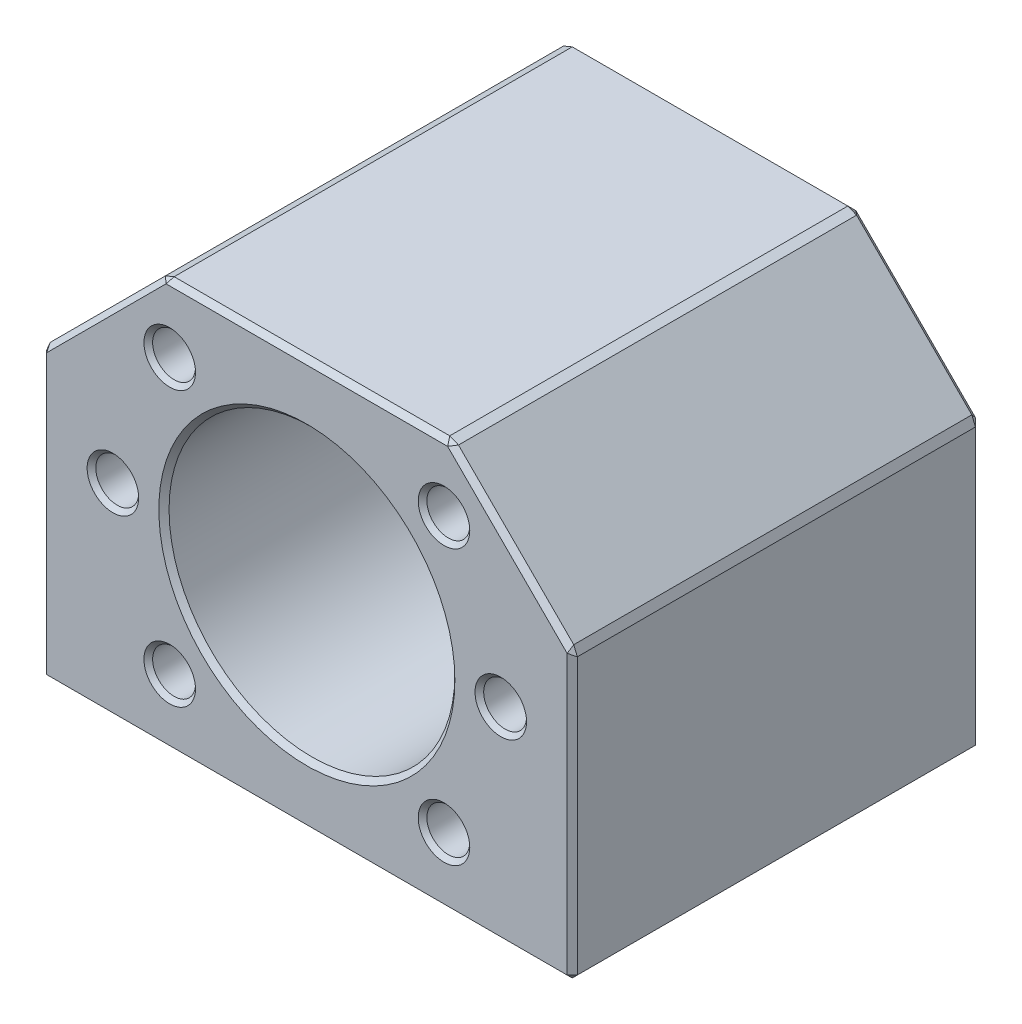
from build123d import *

# Parameters (mm, degrees)
SKETCH1_R                                 = 14
BOSS_EXTRUDE1_DEPTH                       = 20
M5X0_8_TAPPED_HOLE1_D                     = 4.2
M5X0_8_TAPPED_HOLE1_DEPTH                 = 12.4
M5X0_8_TAPPED_HOLE1_CSINK_D               = 5.05
M5X0_8_TAPPED_HOLE1_CSINK_ANGLE           = 90
M5X0_8_TAPPED_HOLE1_TIP                   = 1.2618073
M5X0_8_TAPPED_HOLE1_ON_FACE_2_D           = 4.2
M5X0_8_TAPPED_HOLE1_ON_FACE_2_DEPTH       = 12.4
M5X0_8_TAPPED_HOLE1_ON_FACE_2_CSINK_D     = 5.05
M5X0_8_TAPPED_HOLE1_ON_FACE_2_CSINK_ANGLE = 90
M5X0_8_TAPPED_HOLE1_ON_FACE_2_TIP         = 1.2618073


with BuildPart() as part:
    # Sketch1 → Boss-Extrude1 (new, symmetric)
    with BuildSketch(Plane.XY):
        Polygon((26, -20), (26, 8), (14, 20), (-14, 20), (-26, 8), (-26, -20), align=None)
        Circle(SKETCH1_R, mode=Mode.SUBTRACT)
    extrude(amount=BOSS_EXTRUDE1_DEPTH, both=True)

    # M5x0.8 Tapped Hole1
    with Locations(Plane(origin=(13.435028843, 13.435028843, 20), x_dir=(1, 0, 0), z_dir=(0, 0, 1))):
        with Locations((0, 0), (5.564971157, -13.435028843), (0, -26.870057686), (-26.870057686, -26.870057686), (-32.435028843, -13.435028843), (-26.870057686, 0)):
            CounterSinkHole(M5X0_8_TAPPED_HOLE1_D / 2, M5X0_8_TAPPED_HOLE1_CSINK_D / 2, depth=M5X0_8_TAPPED_HOLE1_DEPTH, counter_sink_angle=M5X0_8_TAPPED_HOLE1_CSINK_ANGLE)
            with Locations((0, 0, -(M5X0_8_TAPPED_HOLE1_DEPTH + M5X0_8_TAPPED_HOLE1_TIP / 2))):  # 118° drill point
                Cone(0, M5X0_8_TAPPED_HOLE1_D / 2, M5X0_8_TAPPED_HOLE1_TIP, mode=Mode.SUBTRACT)

    # M5x0.8 Tapped Hole1 on face 2
    with Locations(Plane(origin=(20, -20, 12), x_dir=(0, 0, -1), z_dir=(0, -1, 0))):
        with Locations((0, 0), (24, 0), (24, -40), (0, -40)):
            CounterSinkHole(M5X0_8_TAPPED_HOLE1_ON_FACE_2_D / 2, M5X0_8_TAPPED_HOLE1_ON_FACE_2_CSINK_D / 2, depth=M5X0_8_TAPPED_HOLE1_ON_FACE_2_DEPTH, counter_sink_angle=M5X0_8_TAPPED_HOLE1_ON_FACE_2_CSINK_ANGLE)
            with Locations((0, 0, -(M5X0_8_TAPPED_HOLE1_ON_FACE_2_DEPTH + M5X0_8_TAPPED_HOLE1_ON_FACE_2_TIP / 2))):  # 118° drill point
                Cone(0, M5X0_8_TAPPED_HOLE1_ON_FACE_2_D / 2, M5X0_8_TAPPED_HOLE1_ON_FACE_2_TIP, mode=Mode.SUBTRACT)

    # Chamfer1
    # the kernel refuses this chamfer: 0.5 mm, written as the material it takes off along each edge
    with BuildSketch(Plane(origin=(25.715482203, 7.88214887, 19.666666667), x_dir=(-0.6532814824381883, 0.38268343236508934, 0.6532814824381883), z_dir=(0.7569751589577588, 0.31354937721983284, 0.5733021862560186)), Plane(origin=(-13.88214887, 19.715482203, 19.666666667), x_dir=(-0.38268343236508734, -0.653281482438189, 0.653281482438189), z_dir=(-0.3135493772198326, 0.7569751589577584, 0.5733021862560194))) as chamfer1_piece_1:
        Polygon((-0.440992496, 0.245543339), (0.324374368, 0.245543339), (0.116618128, -0.491086678), align=None)
    extrude(amount=0.48776836, mode=Mode.SUBTRACT)
    with BuildSketch(Plane(origin=(13.88214887, 19.715482203, 19.666666667), x_dir=(0.3826834323650941, -0.6532814824381893, 0.6532814824381846), z_dir=(0.3135493772198325, 0.7569751589577581, 0.57330218625602)), Plane(origin=(-13.88214887, 19.715482203, -19.666666667), x_dir=(-0.38268343236508734, -0.653281482438189, -0.653281482438189), z_dir=(-0.3135493772198326, 0.7569751589577584, -0.5733021862560194))) as chamfer1_piece_2:
        Polygon((-0.440992496, -0.245543339), (0.324374368, -0.245543339), (0.116618128, 0.491086678), align=None)
    extrude(amount=0.48776836, mode=Mode.SUBTRACT)
    with BuildSketch(Plane(origin=(-25.666666667, -19.666666667, 19.666666667), x_dir=(-0.7071067811865475, 0.7071067811865475, 0), z_dir=(-0.5773502691896258, -0.5773502691896258, 0.5773502691896258)), Plane(origin=(25.666666667, -19.666666667, 19.666666667), x_dir=(-0.7071067811865475, -0.7071067811865475, 0), z_dir=(0.5773502691896258, -0.5773502691896258, 0.5773502691896258))) as chamfer1_piece_3:
        Polygon((-0.353553391, 0.204124145), (0.353553391, 0.204124145), (0, -0.40824829), align=None)
    extrude(amount=0.635085296, mode=Mode.SUBTRACT)
    with BuildSketch(Plane(origin=(-25.666666667, -19.666666667, -19.666666667), x_dir=(0, -0.7071067811865475, 0.7071067811865475), z_dir=(-0.5773502691896258, -0.5773502691896258, -0.5773502691896258)), Plane(origin=(25.666666667, -19.666666667, -19.666666667), x_dir=(-0.7071067811865475, -0.7071067811865475, 0), z_dir=(0.5773502691896258, -0.5773502691896258, -0.5773502691896258))) as chamfer1_piece_4:
        Polygon((-0.353553391, -0.204124145), (0.353553391, -0.204124145), (0, 0.40824829), align=None)
    extrude(amount=0.635085296, mode=Mode.SUBTRACT)
    with BuildSketch(Plane(origin=(-25.715482203, 7.88214887, 19.666666667), x_dir=(-0.6532814824381881, -0.38268343236509034, -0.6532814824381881), z_dir=(-0.7569751589577591, 0.3135493772198332, 0.573302186256018))) as chamfer1_piece_5:
        Polygon((-0.324374368, 0.245543339), (0.440992496, 0.245543339), (-0.116618128, -0.491086678), align=None)
    extrude(amount=0.48776836, mode=Mode.SUBTRACT)
    with BuildSketch(Plane(origin=(-25.715482203, 7.88214887, -19.666666667), x_dir=(-0.6532814824381881, -0.38268343236509034, 0.6532814824381881), z_dir=(-0.7569751589577591, 0.3135493772198332, -0.573302186256018))) as chamfer1_piece_6:
        Polygon((-0.324374368, -0.245543339), (0.440992496, -0.245543339), (-0.116618128, 0.491086678), align=None)
    extrude(amount=0.48776836, mode=Mode.SUBTRACT)
    with BuildSketch(Plane(origin=(13.88214887, 19.715482203, -19.666666667), x_dir=(0.9238795325112866, -0.38268343236509006, 0), z_dir=(0.3135493772198331, 0.756975158957758, -0.5733021862560196))) as chamfer1_piece_7:
        Polygon((-0.461939766, -0.203414762), (0.461939766, -0.203414762), (0, 0.406829525), align=None)
    extrude(amount=0.48776836, mode=Mode.SUBTRACT)
    with BuildSketch(Plane(origin=(25.715482203, 7.88214887, -19.666666667), x_dir=(-0.3826834323650894, 0.923879532511287, 0), z_dir=(0.7569751589577588, 0.31354937721983284, -0.5733021862560186))) as chamfer1_piece_8:
        Polygon((-0.461939766, 0.203414762), (0.461939766, 0.203414762), (0, -0.406829525), align=None)
    extrude(amount=0.48776836, mode=Mode.SUBTRACT)
    with BuildSketch(Plane(origin=(26.90922724, 7.09077276, 20), x_dir=(-0.7068394360706732, -0.7068394360706736, 0.027495876610589012), z_dir=(-0.7071067811865478, 0.7071067811865474, 0)), Plane(origin=(-13.09077276, 20.90922724, -20), x_dir=(-0.01944252080601374, 0.01944252080601374, 0.9996219169112968), z_dir=(-0.7071067811865476, -0.7071067811865476, 0)), Plane(origin=(26.90922724, 7.09077276, -20), x_dir=(0.01944252080601546, 0.019442520806015474, 0.9996219169112968), z_dir=(-0.7071067811865478, 0.7071067811865474, 0))) as chamfer1_piece_9:
        with BuildLine():
            Line((0.514336598, 0), (-0.028273577, -0.513558897))
            Line((-0.028273577, -0.513558897), (-0.038269797, -0.513283938))
            ThreePointArc((-0.038269797, -0.513283938), (-0.017064614, -0.256698915), (-0.009996219, 0.000274959))
            Line((-0.009996219, 0.000274959), (0.000274959, 0.009996219))
            ThreePointArc((0.000274959, 0.009996219), (0.257248832, 0.002927825), (0.514611556, 0.009996219))
            Line((0.514611556, 0.009996219), (0.514336598, 0))
        make_face()
    extrude(amount=19.542245736, mode=Mode.SUBTRACT)
    with BuildSketch(Plane(origin=(-26, -20, 21.285841494), x_dir=(0.9996219169112968, -0.027495876610589005, 0), z_dir=(0, 0, -1)), Plane(origin=(26, -20, 21.285841494), x_dir=(0.027495876610589005, 0.9996219169112968, 0), z_dir=(0, 0, -1))) as chamfer1_piece_10:
        with BuildLine():
            Line((0.514336598, 0), (-0.028273577, -0.513558897))
            Line((-0.028273577, -0.513558897), (-0.038269797, -0.513283938))
            ThreePointArc((-0.038269797, -0.513283938), (-0.017064614, -0.256698915), (-0.009996219, 0.000274959))
            Line((-0.009996219, 0.000274959), (0.000274959, 0.009996219))
            ThreePointArc((0.000274959, 0.009996219), (0.257248832, 0.002927825), (0.514611556, 0.009996219))
            Line((0.514611556, 0.009996219), (0.514336598, 0))
        make_face()
    extrude(amount=42.571682988, mode=Mode.SUBTRACT)
    with BuildSketch(Plane(origin=(-26, 8, 21.296335196), x_dir=(-0.014760203742519438, -0.9998910622590239, 0), z_dir=(0, 0, -1)), Plane(origin=(26, 8, -21.296335196), x_dir=(0.014760203742519464, -0.9998910622590239, 0), z_dir=(0, 0, 1))) as chamfer1_piece_11:
        with BuildLine():
            Line((0.518534079, 0), (-0.377321943, -0.355676457))
            Line((-0.377321943, -0.355676457), (-0.38428787, -0.348501789))
            ThreePointArc((-0.38428787, -0.348501789), (-0.192961154, -0.173409187), (-0.006965927, 0.007174668))
            Line((-0.006965927, 0.007174668), (0.000147602, 0.009998911))
            ThreePointArc((0.000147602, 0.009998911), (0.259358156, 0.006172493), (0.518681681, 0.009998911))
            Line((0.518681681, 0.009998911), (0.518534079, 0))
        make_face()
    extrude(amount=42.592670393, mode=Mode.SUBTRACT)
    with BuildSketch(Plane(origin=(-14, 20, -21.296335196), x_dir=(-0.7174667907292103, -0.696592710413142, 0), z_dir=(0, 0, 1)), Plane(origin=(14, 20, -21.296335196), x_dir=(-0.9998910622590239, 0.014760203742519438, 0), z_dir=(0, 0, 1))) as chamfer1_piece_12:
        with BuildLine():
            Line((0.518534079, 0), (-0.377321943, 0.355676457))
            Line((-0.377321943, 0.355676457), (-0.38428787, 0.348501789))
            ThreePointArc((-0.38428787, 0.348501789), (-0.192961154, 0.173409187), (-0.006965927, -0.007174668))
            Line((-0.006965927, -0.007174668), (0.000147602, -0.009998911))
            ThreePointArc((0.000147602, -0.009998911), (0.259358156, -0.006172493), (0.518681681, -0.009998911))
            Line((0.518681681, -0.009998911), (0.518534079, 0))
        make_face()
    extrude(amount=42.592670393, mode=Mode.SUBTRACT)
    with BuildSketch(Plane(origin=(15.285841494, 20, 20), x_dir=(0, 0.027495876610589005, -0.9996219169112968), z_dir=(-1, 0, 0)), Plane(origin=(-26, 9.285841494, 20), x_dir=(-0.027495876610589005, 0, -0.9996219169112968), z_dir=(0, -1, 0)), Plane(origin=(26, -21.285841494, 20), x_dir=(0.027495876610589005, 0, -0.9996219169112968), z_dir=(0, 1, 0))) as chamfer1_piece_13:
        with BuildLine():
            Line((0.514336598, 0), (-0.028273577, 0.513558897))
            Line((-0.028273577, 0.513558897), (-0.038269797, 0.513283938))
            ThreePointArc((-0.038269797, 0.513283938), (-0.017064614, 0.256698915), (-0.009996219, -0.000274959))
            Line((-0.009996219, -0.000274959), (0.000274959, -0.009996219))
            ThreePointArc((0.000274959, -0.009996219), (0.257248832, -0.002927825), (0.514611556, -0.009996219))
            Line((0.514611556, -0.009996219), (0.514336598, 0))
        make_face()
    extrude(amount=30.571682988, mode=Mode.SUBTRACT)
    with BuildSketch(Plane(origin=(-13.09077276, 20.90922724, 20), x_dir=(-0.01944252080601374, 0.01944252080601374, -0.9996219169112968), z_dir=(-0.7071067811865476, -0.7071067811865476, 0))) as chamfer1_piece_14:
        with BuildLine():
            Line((0.514336598, 0), (-0.028273577, 0.513558897))
            Line((-0.028273577, 0.513558897), (-0.038269797, 0.513283938))
            ThreePointArc((-0.038269797, 0.513283938), (-0.017064614, 0.256698915), (-0.009996219, -0.000274959))
            Line((-0.009996219, -0.000274959), (0.000274959, -0.009996219))
            ThreePointArc((0.000274959, -0.009996219), (0.257248832, -0.002927825), (0.514611556, -0.009996219))
            Line((0.514611556, -0.009996219), (0.514336598, 0))
        make_face()
    extrude(amount=19.542245736, mode=Mode.SUBTRACT)
    with BuildSketch(Plane(origin=(0, 0, -20), x_dir=(1, 0, 0), z_dir=(0, -1, 0))) as chamfer1_piece_15:
        with BuildLine():
            Line((13.985857864, 0.514142136), (14.514142136, -0.014142136))
            Line((14.514142136, -0.014142136), (14.514142136, -0.024142136))
            ThreePointArc((14.514142136, -0.024142136), (14.257071068, -0.01), (14, -0.01))
            Line((14, -0.01), (13.99, 0))
            ThreePointArc((13.99, 0), (13.99, 0.257071068), (13.975857864, 0.514142136))
            Line((13.975857864, 0.514142136), (13.985857864, 0.514142136))
        make_face()
    revolve(axis=Axis((0, 0, -20), (0, 0, 1)), mode=Mode.SUBTRACT)
    with BuildSketch(Plane(origin=(0, 0, 20), x_dir=(1, 0, 0), z_dir=(0, -1, 0))) as chamfer1_piece_16:
        with BuildLine():
            Line((14.514142136, 0.014142136), (13.985857864, -0.514142136))
            Line((13.985857864, -0.514142136), (13.975857864, -0.514142136))
            ThreePointArc((13.975857864, -0.514142136), (13.99, -0.257071068), (13.99, 0))
            Line((13.99, 0), (14, 0.01))
            ThreePointArc((14, 0.01), (14.257071068, 0.01), (14.514142136, 0.024142136))
            Line((14.514142136, 0.024142136), (14.514142136, 0.014142136))
        make_face()
    revolve(axis=Axis((0, 0, 20), (0, 0, 1)), mode=Mode.SUBTRACT)
    with BuildSketch(Plane(origin=(-27.285841494, -20, 20), x_dir=(0, -0.027495876610589005, -0.9996219169112968), z_dir=(1, 0, 0))) as chamfer1_piece_17:
        with BuildLine():
            Line((0.514336598, 0), (-0.028273577, 0.513558897))
            Line((-0.028273577, 0.513558897), (-0.038269797, 0.513283938))
            ThreePointArc((-0.038269797, 0.513283938), (-0.017064614, 0.256698915), (-0.009996219, -0.000274959))
            Line((-0.009996219, -0.000274959), (0.000274959, -0.009996219))
            ThreePointArc((0.000274959, -0.009996219), (0.257248832, -0.002927825), (0.514611556, -0.009996219))
            Line((0.514611556, -0.009996219), (0.514336598, 0))
        make_face()
    extrude(amount=54.571682988, mode=Mode.SUBTRACT)
    with BuildSketch(Plane(origin=(-26, 9.285841494, -20), x_dir=(-0.027495876610589005, 0, 0.9996219169112968), z_dir=(0, -1, 0)), Plane(origin=(15.285841494, 20, -20), x_dir=(0, 0.027495876610589005, 0.9996219169112968), z_dir=(-1, 0, 0)), Plane(origin=(26, -21.285841494, -20), x_dir=(0.027495876610589005, 0, 0.9996219169112968), z_dir=(0, 1, 0))) as chamfer1_piece_18:
        with BuildLine():
            Line((0.514336598, 0), (-0.028273577, -0.513558897))
            Line((-0.028273577, -0.513558897), (-0.038269797, -0.513283938))
            ThreePointArc((-0.038269797, -0.513283938), (-0.017064614, -0.256698915), (-0.009996219, 0.000274959))
            Line((-0.009996219, 0.000274959), (0.000274959, 0.009996219))
            ThreePointArc((0.000274959, 0.009996219), (0.257248832, 0.002927825), (0.514611556, 0.009996219))
            Line((0.514611556, 0.009996219), (0.514336598, 0))
        make_face()
    extrude(amount=30.571682988, mode=Mode.SUBTRACT)
    with BuildSketch(Plane(origin=(-27.285841494, -20, -20), x_dir=(0, -0.027495876610589005, 0.9996219169112968), z_dir=(1, 0, 0))) as chamfer1_piece_19:
        with BuildLine():
            Line((0.514336598, 0), (-0.028273577, -0.513558897))
            Line((-0.028273577, -0.513558897), (-0.038269797, -0.513283938))
            ThreePointArc((-0.038269797, -0.513283938), (-0.017064614, -0.256698915), (-0.009996219, 0.000274959))
            Line((-0.009996219, 0.000274959), (0.000274959, 0.009996219))
            ThreePointArc((0.000274959, 0.009996219), (0.257248832, 0.002927825), (0.514611556, 0.009996219))
            Line((0.514611556, 0.009996219), (0.514336598, 0))
        make_face()
    extrude(amount=54.571682988, mode=Mode.SUBTRACT)


solid = part.part
